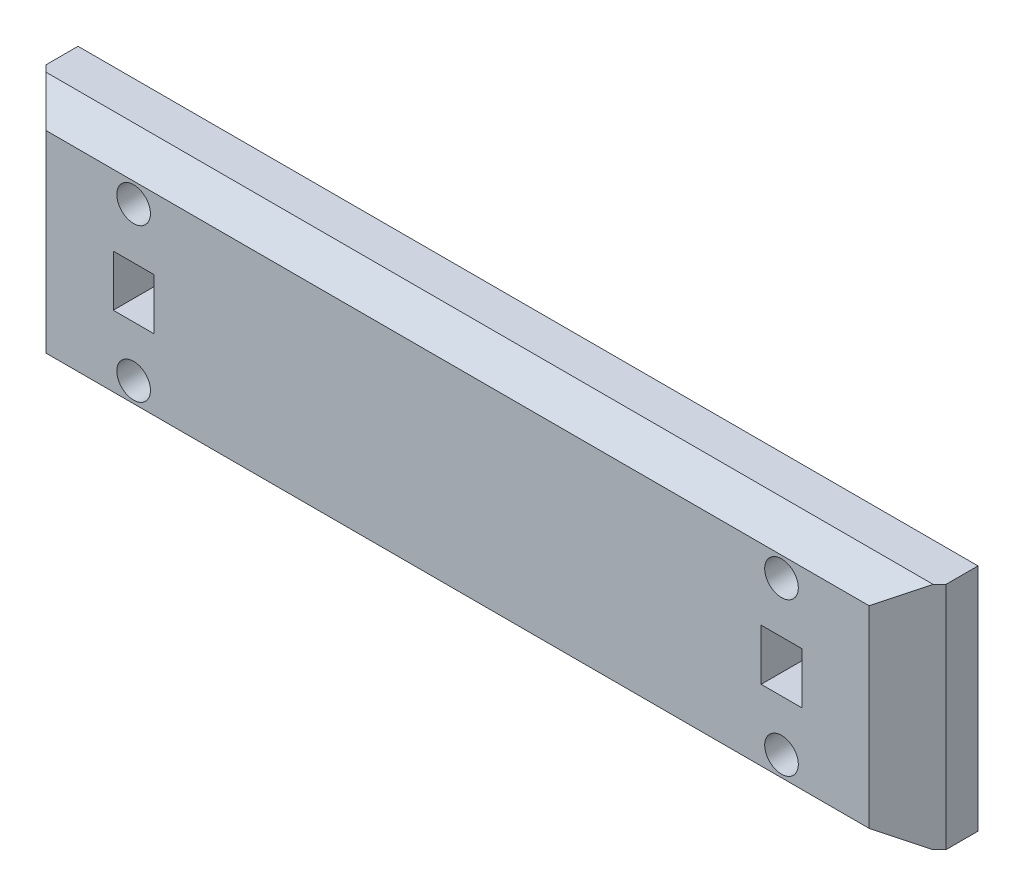
from build123d import *
from OCP.BRepFilletAPI import BRepFilletAPI_MakeChamfer

# Parameters (mm, degrees)
SKETCH1_W           = 12.7
SKETCH1_H           = 16
BOSS_EXTRUDE1_DEPTH = 22
SKETCH2_R           = 2.75
CUT_EXTRUDE1_DEPTH  = 240.682575556
SKETCH5_W           = 169.595
SKETCH5_H           = 59.75
CUT_EXTRUDE3_DEPTH  = 8
CHAMFER1_SIZE       = 10
CHAMFER1_SIZE2      = 5.773502692
SKETCH7_R           = 5.25
CUT_EXTRUDE4_DEPTH  = 10
CHAMFER2_SIZE       = 12


with BuildPart() as part:
    # Sketch1 → Boss-Extrude1 (new body)
    with BuildSketch(Plane.XY):
        Polygon((-12.7, 31.75), (202.295, 31.75), (235.295, 31.75), (235.295, -40), (202.295, -40), (-12.7, -40), (-45.7, -40), (-45.7, 31.75), align=None)
        with Locations((-6.35, -4.125)):
            Rectangle(SKETCH1_W, SKETCH1_H, mode=Mode.SUBTRACT)
        with Locations((195.945, -4.125)):
            Rectangle(SKETCH1_W, SKETCH1_H, mode=Mode.SUBTRACT)
    extrude(amount=BOSS_EXTRUDE1_DEPTH)

    # Sketch2 → Cut-Extrude1 (cut, through all)
    with BuildSketch(Plane.XY.offset(22)):
        with Locations((-6.35, 19.75)):
            Circle(SKETCH2_R)
        with Locations((-6.35, -28)):
            Circle(SKETCH2_R)
        with Locations((195.945, -28)):
            Circle(SKETCH2_R)
        with Locations((195.945, 19.75)):
            Circle(SKETCH2_R)
    extrude(amount=-CUT_EXTRUDE1_DEPTH, mode=Mode.SUBTRACT)

    # Sketch5 → Cut-Extrude3 (cut)
    with BuildSketch(Plane(origin=(0, 0, 0), x_dir=(-1, 0, 0), z_dir=(0, 0, -1))):
        with Locations((-94.7975, -10.125)):
            Rectangle(SKETCH5_W, SKETCH5_H)
    extrude(amount=-CUT_EXTRUDE3_DEPTH, mode=Mode.SUBTRACT)

    # Chamfer1: one chamfer whose edges measure the first distance from different faces: ONE call of the kernel's chamfer builder (chamfer() names one face for all edges)
    chamfer1_edges_1 = [part.edges().sort_by_distance(p)[0] for p in [
        (94.7975, 31.75, 22),
    ]]
    chamfer1_side_1 = [part.faces().sort_by_distance(p)[0] for p in [
        (94.7975, 31.75, 11),
    ]]
    chamfer1_edges_2 = [part.edges().sort_by_distance(p)[0] for p in [
        (94.7975, -40, 22),
    ]]
    chamfer1_side_2 = [part.faces().sort_by_distance(p)[0] for p in [
        (94.7975, -40, 12.968303445),
    ]]
    chamfer1 = BRepFilletAPI_MakeChamfer(part.part.solid().wrapped)
    for e in chamfer1_edges_1:
        chamfer1.Add(CHAMFER1_SIZE, CHAMFER1_SIZE2, e.wrapped, chamfer1_side_1[0].wrapped)  # the first distance lies on this face
    for e in chamfer1_edges_2:
        chamfer1.Add(CHAMFER1_SIZE, CHAMFER1_SIZE2, e.wrapped, chamfer1_side_2[0].wrapped)  # the first distance lies on this face
    add(Compound.cast(chamfer1.Shape()), mode=Mode.REPLACE)

    # Sketch7 → Cut-Extrude4 (cut)
    with BuildSketch(Plane.XY.offset(22)):
        with Locations((-6.35, 19.75)):
            Circle(SKETCH7_R)
        with Locations((-6.35, -28)):
            Circle(SKETCH7_R)
        with Locations((195.945, 19.75)):
            Circle(SKETCH7_R)
        with Locations((195.945, -28)):
            Circle(SKETCH7_R)
    extrude(amount=-CUT_EXTRUDE4_DEPTH, mode=Mode.SUBTRACT)

    # Chamfer2
    chamfer2_edges = [part.edges().sort_by_distance(p)[0] for p in [
        (-45.7, -4.125, 22),
        (235.295, -4.125, 22),
    ]]
    chamfer(chamfer2_edges, length=CHAMFER2_SIZE)


solid = part.part
